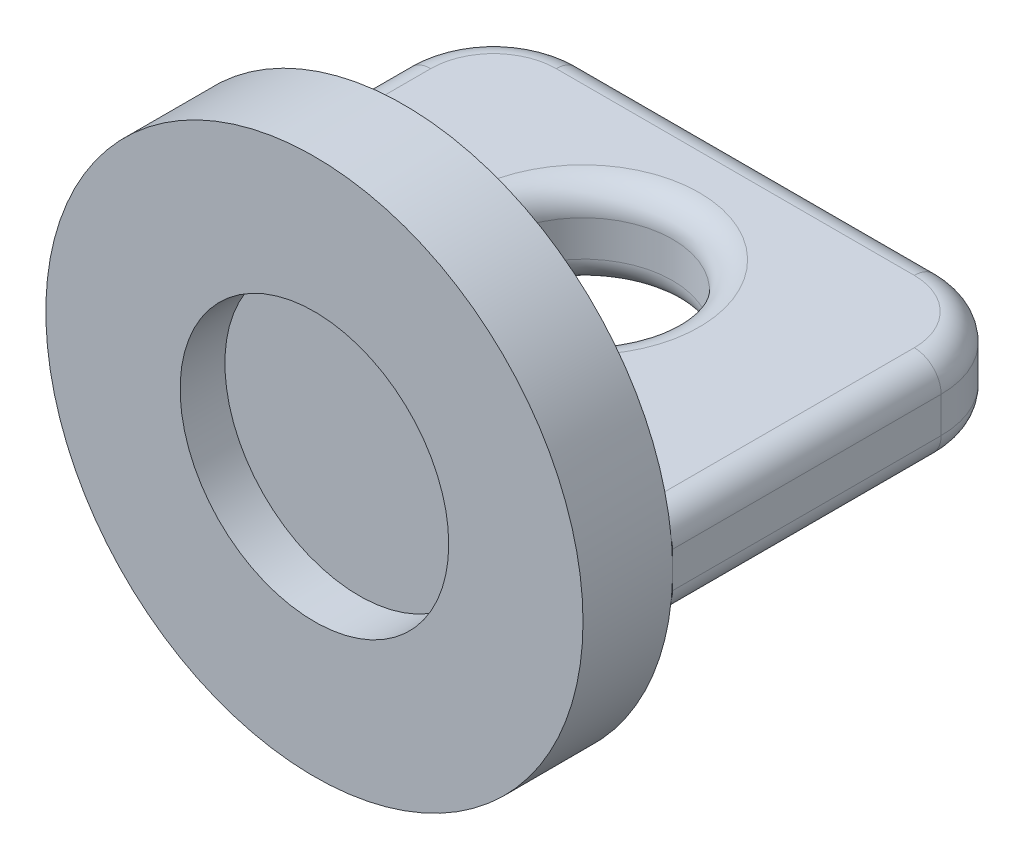
from build123d import *

# Parameters (mm, degrees)
CROQUIS1_R              = 30
SALIENTE_EXTRUIR1_DEPTH = 10
CROQUIS2_W              = 60
CROQUIS2_H              = 40
SALIENTE_EXTRUIR2_DEPTH = 5
REDONDEO1_R             = 10
REDONDEO2_R             = 3
CROQUIS3_R              = 15
CORTAR_EXTRUIR1_DEPTH   = 5
CROQUIS4_R              = 10
CORTAR_EXTRUIR2_DEPTH   = 62.032778128
REDONDEO3_R             = 3


with BuildPart() as part:
    # Croquis1 → Saliente-Extruir1 (new body)
    with BuildSketch(Plane.XY):
        Circle(CROQUIS1_R)
    extrude(amount=SALIENTE_EXTRUIR1_DEPTH)

    # Croquis2 → Saliente-Extruir2 (add, symmetric)
    with BuildSketch(Plane(origin=(0, 0, 0), x_dir=(1, 0, 0), z_dir=(0, 1, 0))):
        with Locations((0, 20)):
            Rectangle(CROQUIS2_W, CROQUIS2_H)
    extrude(amount=SALIENTE_EXTRUIR2_DEPTH, both=True)

    # Redondeo1
    redondeo1_edges = [part.edges().sort_by_distance(p)[0] for p in [
        (-30, 0, -40),
        (30, 0, -40),
    ]]
    fillet(redondeo1_edges, radius=REDONDEO1_R)

    # Redondeo2
    # the kernel refuses this fillet: 3 mm, written as the material it takes off along each edge
    with BuildSketch(Plane(origin=(30, -5, 0), x_dir=(0, 1, 0), z_dir=(0, 0, -1)), Plane(origin=(30, 5, 0), x_dir=(-1, 0, 0), z_dir=(0, 0, -1)), Plane(origin=(-30, -5, -30), x_dir=(0, 1, 0), z_dir=(0, 0, 1)), Plane(origin=(-30, 5, -30), x_dir=(1, 0, 0), z_dir=(0, 0, 1))) as redondeo2_piece_1:
        with BuildLine():
            CenterArc((REDONDEO2_R, -REDONDEO2_R), REDONDEO2_R, 90, 90)
            Line((0, -REDONDEO2_R), (0, 0))
            Line((0, 0), (REDONDEO2_R, 0))
        make_face()
    extrude(amount=30, mode=Mode.SUBTRACT)
    with BuildSketch(Plane(origin=(20, -5, -40), x_dir=(0, 1, 0), z_dir=(-1, 0, 0)), Plane(origin=(20, 5, -40), x_dir=(0, 0, 1), z_dir=(-1, 0, 0))) as redondeo2_piece_2:
        with BuildLine():
            CenterArc((REDONDEO2_R, -REDONDEO2_R), REDONDEO2_R, 90, 90)
            Line((0, -REDONDEO2_R), (0, 0))
            Line((0, 0), (REDONDEO2_R, 0))
        make_face()
    extrude(amount=40, mode=Mode.SUBTRACT)
    with BuildSketch(Plane(origin=(-20, -5, -30), x_dir=(-1, 0, 0), z_dir=(0, 0, 1))) as redondeo2_piece_3:
        with BuildLine():
            CenterArc((10 - REDONDEO2_R, -REDONDEO2_R), REDONDEO2_R, 0, 90)
            Line((10 - REDONDEO2_R, 0), (10, 0))
            Line((10, 0), (10, -REDONDEO2_R))
        make_face()
    revolve(axis=Axis((-20, -5, -30), (0, -1, 0)), revolution_arc=90, mode=Mode.SUBTRACT)
    with BuildSketch(Plane(origin=(20, -5, -30), x_dir=(1, 0, 0), z_dir=(0, 0, 1))) as redondeo2_piece_4:
        with BuildLine():
            CenterArc((10 - REDONDEO2_R, REDONDEO2_R), REDONDEO2_R, 270, 90)
            Line((10 - REDONDEO2_R, 0), (10, 0))
            Line((10, 0), (10, REDONDEO2_R))
        make_face()
    revolve(axis=Axis((20, -5, -30), (0, 1, 0)), revolution_arc=90, mode=Mode.SUBTRACT)
    with BuildSketch(Plane(origin=(-20, 5, -30), x_dir=(-1, 0, 0), z_dir=(0, 0, 1))) as redondeo2_piece_5:
        with BuildLine():
            CenterArc((10 - REDONDEO2_R, REDONDEO2_R), REDONDEO2_R, 270, 90)
            Line((10, REDONDEO2_R), (10, 0))
            Line((10, 0), (10 - REDONDEO2_R, 0))
        make_face()
    revolve(axis=Axis((-20, 5, -30), (0, -1, 0)), revolution_arc=90, mode=Mode.SUBTRACT)
    with BuildSketch(Plane(origin=(20, 5, -30), x_dir=(1, 0, 0), z_dir=(0, 0, 1))) as redondeo2_piece_6:
        with BuildLine():
            CenterArc((10 - REDONDEO2_R, -REDONDEO2_R), REDONDEO2_R, 0, 90)
            Line((10, -REDONDEO2_R), (10, 0))
            Line((10, 0), (10 - REDONDEO2_R, 0))
        make_face()
    revolve(axis=Axis((20, 5, -30), (0, 1, 0)), revolution_arc=90, mode=Mode.SUBTRACT)

    # Croquis3 → Cortar-Extruir1 (cut)
    with BuildSketch(Plane.XY.offset(10)):
        Circle(CROQUIS3_R)
    extrude(amount=-CORTAR_EXTRUIR1_DEPTH, mode=Mode.SUBTRACT)

    # Croquis4 → Cortar-Extruir2 (cut, through all)
    with BuildSketch(Plane.XZ.offset(5)):
        with Locations(Location((0, -20, 0), (0, 0, 270))):
            Circle(CROQUIS4_R)
    extrude(amount=-CORTAR_EXTRUIR2_DEPTH, mode=Mode.SUBTRACT)

    # Redondeo3
    redondeo3_edges = [part.edges().sort_by_distance(p)[0] for p in [
        (0, 5, -10),
        (0, -5, -10),
    ]]
    fillet(redondeo3_edges, radius=REDONDEO3_R)


solid = part.part
